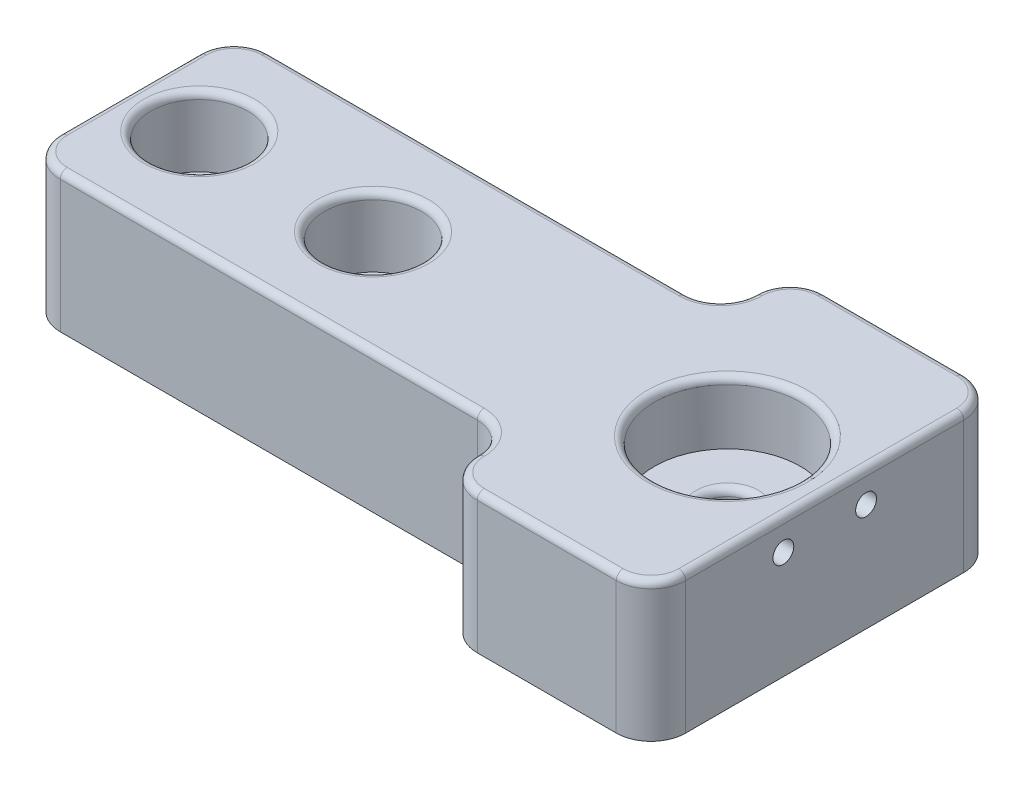
from build123d import *

# Parameters (mm, degrees)
SKETCH1_W               = 100
SKETCH1_H               = 30
SKETCH1_R               = 3.5
BOSS_EXTRUDE1_DEPTH     = 20
SKETCH2_R               = 10.5
CUT_EXTRUDE1_DEPTH      = 9
CUT_EXTRUDE2_REACH      = 105.078
CUT_EXTRUDE2_END_RADIUS = 10.5
SKETCH3_R               = 1.5
SKETCH4_W               = 30
SKETCH4_H               = 10
BOSS_EXTRUDE2_DEPTH     = 20
SKETCH5_R               = 7
CUT_EXTRUDE3_DEPTH      = 10
FILLET1_R               = 5
FILLET2_R               = 1


with BuildPart() as part:
    # Sketch1 → Boss-Extrude1 (new body)
    with BuildSketch(Plane(origin=(0, 0, 0), x_dir=(1, 0, 0), z_dir=(0, 1, 0))):
        Rectangle(SKETCH1_W, SKETCH1_H)
        with Locations(Location((36, 0, 0), (0, 0, 270))):
            Circle(SKETCH1_R, mode=Mode.SUBTRACT)
        with Locations(Location((-40, 0, 0), (0, 0, 270))):
            Circle(SKETCH1_R, mode=Mode.SUBTRACT)
        with Locations(Location((-15, 0, 0), (0, 0, 270))):
            Circle(SKETCH1_R, mode=Mode.SUBTRACT)
    extrude(amount=BOSS_EXTRUDE1_DEPTH)

    # Sketch2 → Cut-Extrude1 (cut)
    with BuildSketch(Plane(origin=(0, 20, 0), x_dir=(1, 0, 0), z_dir=(0, 1, 0))):
        with Locations(Location((36, 0, 0), (0, 0, 270))):
            Circle(SKETCH2_R)
    extrude(amount=-CUT_EXTRUDE1_DEPTH, mode=Mode.SUBTRACT)

    # Cut-Extrude2: up to this cylinder (the profile starts outside it)
    cut_extrude2_end = Plane(origin=(36, 15.5, 0), z_dir=(0, 1, 0)) * Cylinder(CUT_EXTRUDE2_END_RADIUS, 232.156, mode=Mode.PRIVATE)
    # Sketch3 → Cut-Extrude2 (cut, up to the surface)
    with BuildSketch(Plane(origin=(50, 0, 0), x_dir=(0, 0, -1), z_dir=(1, 0, 0)), mode=Mode.PRIVATE) as cut_extrude2_sk1:
        with Locations((-5.95, 15.5)):
            Circle(SKETCH3_R)
    cut_extrude2_tool1 = extrude(cut_extrude2_sk1.sketch, amount=-CUT_EXTRUDE2_REACH, mode=Mode.PRIVATE) - cut_extrude2_end
    add(cut_extrude2_tool1.solids().sort_by_distance((50, 15.5, 5.95))[0], mode=Mode.SUBTRACT)
    # Sketch3 → Cut-Extrude2 (cut, up to the surface)
    with BuildSketch(Plane(origin=(50, 0, 0), x_dir=(0, 0, -1), z_dir=(1, 0, 0)), mode=Mode.PRIVATE) as cut_extrude2_sk2:
        with Locations((5.95, 15.5)):
            Circle(SKETCH3_R)
    cut_extrude2_tool2 = extrude(cut_extrude2_sk2.sketch, amount=-CUT_EXTRUDE2_REACH, mode=Mode.PRIVATE) - cut_extrude2_end
    add(cut_extrude2_tool2.solids().sort_by_distance((50, 15.5, -5.95))[0], mode=Mode.SUBTRACT)

    # Sketch4 → Boss-Extrude2 (add)
    with BuildSketch(Plane(origin=(0, 20, 0), x_dir=(1, 0, 0), z_dir=(0, 1, 0))):
        with Locations((35, 20)):
            Rectangle(SKETCH4_W, SKETCH4_H)
        with Locations((35, -20)):
            Rectangle(SKETCH4_W, SKETCH4_H)
    extrude(amount=-BOSS_EXTRUDE2_DEPTH)

    # Sketch5 → Cut-Extrude3 (cut)
    with BuildSketch(Plane(origin=(0, 20, 0), x_dir=(1, 0, 0), z_dir=(0, 1, 0))):
        with Locations(Location((-40, 0, 0), (0, 0, 270))):
            Circle(SKETCH5_R)
        with Locations(Location((-15, 0, 0), (0, 0, 270))):
            Circle(SKETCH5_R)
    extrude(amount=-CUT_EXTRUDE3_DEPTH, mode=Mode.SUBTRACT)

    # Fillet1
    fillet1_edges = [part.edges().sort_by_distance(p)[0] for p in [
        (-50, 10, -15),
        (-50, 10, 15),
        (50, 10, 25),
        (20, 10, -15),
        (20, 10, 15),
        (20, 10, 25),
        (50, 10, -25),
        (20, 10, -25),
    ]]
    fillet(fillet1_edges, radius=FILLET1_R - 0.0001)  # a hair under: the kernel refuses the full size

    # Fillet2
    fillet2_edges = [part.edges().sort_by_distance(p)[0] for p in [
        (18.535563195, 20, -16.464436805),
        (18.535563195, 20, 16.464436805),
        (36, 11, -3.5),
        (36, 20, -10.5),
        (-40, 10, -3.5),
        (-40, 20, -7),
        (-15, 10, -3.5),
        (-15, 20, -7),
        (35, 20, 25),
        (50, 20, 0),
        (35, 20, -25),
        (-15, 20, -15),
        (-50, 20, 0),
        (-15, 20, 15),
        (21.464436805, 20, -23.535563195),
        (48.535563195, 20, -23.535563195),
        (-48.535563195, 20, 13.535563195),
        (-48.535563195, 20, -13.535563195),
        (21.464436805, 20, 23.535563195),
        (48.535563195, 20, 23.535563195),
    ]]
    fillet(fillet2_edges, radius=FILLET2_R)


solid = part.part
